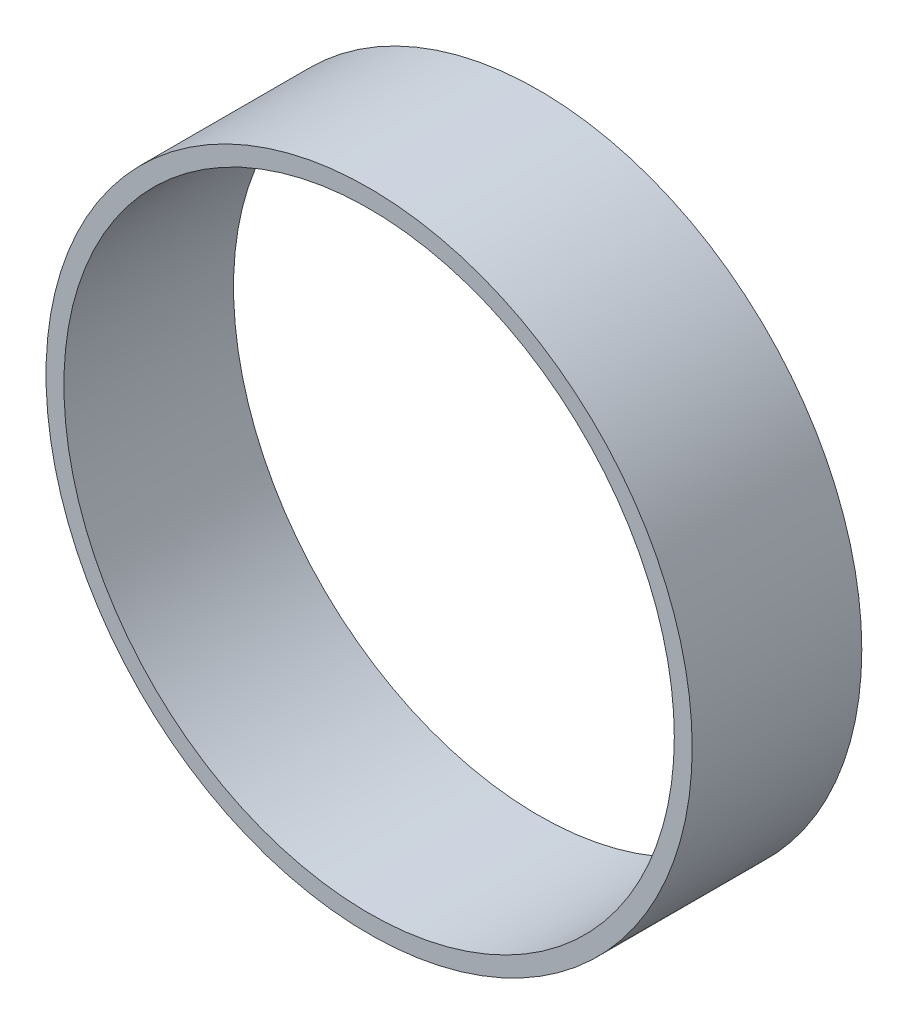
from build123d import *

# Parameters (mm, degrees)
SKETCH1_R           = 38.1
SKETCH1_R_2         = 35.99
BOSS_EXTRUDE1_DEPTH = 20


with BuildPart() as part:
    # Sketch1 → Boss-Extrude1 (new body)
    with BuildSketch(Plane.XY):
        Circle(SKETCH1_R)
        Circle(SKETCH1_R_2, mode=Mode.SUBTRACT)
    extrude(amount=BOSS_EXTRUDE1_DEPTH)


solid = part.part
